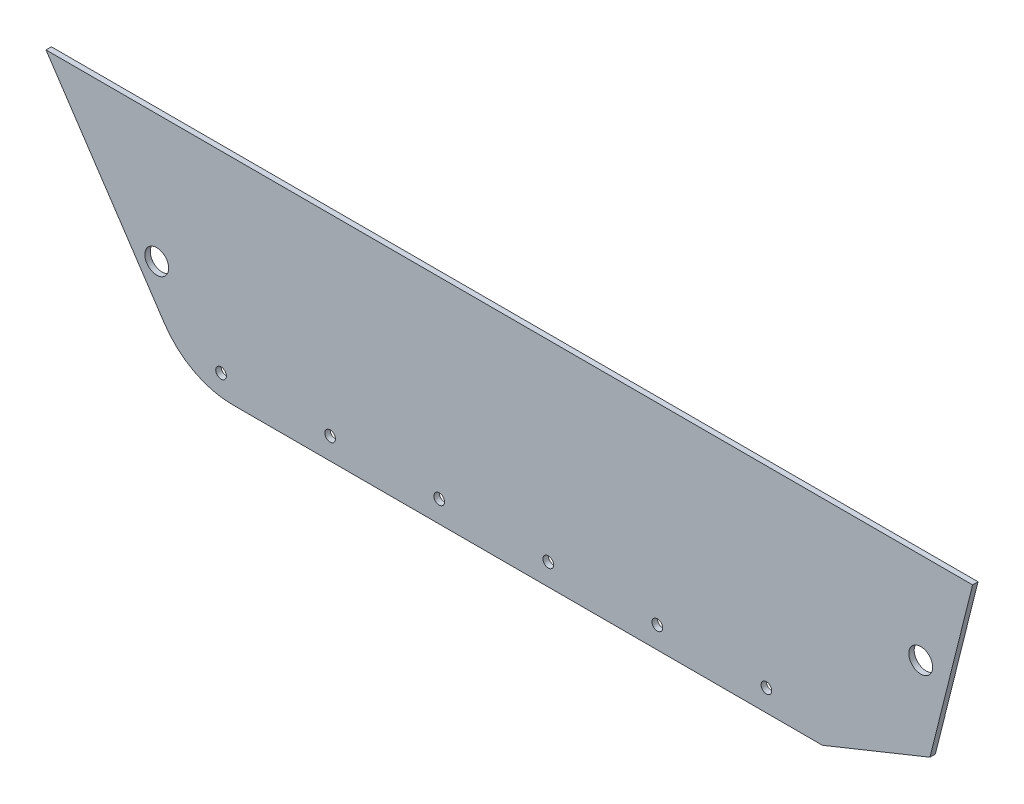
from build123d import *

# Parameters (mm, degrees)
BOSS_EXTRUDE1_DEPTH = 3.175
SKETCH1_4_R         = 3.125
CUT_EXTRUDE1_DEPTH  = 439.905857431
FILLET1_R           = 48
CUT_EXTRUDE3_DEPTH  = 10
CUT_EXTRUDE5_REACH  = 440.906
SKETCH12_R          = 7
SKETCH13_R          = 7
CUT_EXTRUDE6_DEPTH  = 10


with BuildPart() as part:
    # Sketch1 → Boss-Extrude1 (new body)
    with BuildSketch(Plane.XY):
        Polygon((-98.879411765, 3.850980392), (-31.879411765, -96.649019608), (366, -96.649019608), (403.120588235, -71.149019608), (428.120588235, 28.939617947), (-115.605170134, 28.939617947), align=None)
    extrude(amount=BOSS_EXTRUDE1_DEPTH)

    # Sketch1<4> → Cut-Extrude1 (cut, through all)
    with BuildSketch(Plane.XY):
        with Locations((-12.879411765, -83.899019608)):
            Circle(SKETCH1_4_R)
        with Locations((51.120588235, -83.899019608)):
            Circle(SKETCH1_4_R)
        with Locations((115.120588235, -83.899019608)):
            Circle(SKETCH1_4_R)
        with Locations((179.120588235, -83.899019608)):
            Circle(SKETCH1_4_R)
        with Locations((243.120588235, -83.899019608)):
            Circle(SKETCH1_4_R)
        with Locations((307.120588235, -83.899019608)):
            Circle(SKETCH1_4_R)
    extrude(amount=CUT_EXTRUDE1_DEPTH, mode=Mode.SUBTRACT)

    # Fillet1
    fillet1_edges = [part.edges().sort_by_distance(p)[0] for p in [
        (-31.879411765, -96.649019608, 1.5875),
    ]]
    fillet(fillet1_edges, radius=FILLET1_R)

    # Sketch7 → Cut-Extrude3 (cut)
    with BuildSketch(Plane.XY.offset(3.175)):
        Polygon((403.120588235, -71.149019608), (340.005873473, -96.649019608), (366, -96.649019608), align=None)
    extrude(amount=-CUT_EXTRUDE3_DEPTH, mode=Mode.SUBTRACT)

    # Sketch12 → Cut-Extrude5 (cut, up to next)
    with BuildSketch(Plane.XY.offset(3.175), mode=Mode.PRIVATE) as cut_extrude5_sk1:
        with Locations((397.677759779, -24.610405856)):
            Circle(SKETCH12_R)
    cut_extrude5_tool1 = extrude(cut_extrude5_sk1.sketch, amount=-CUT_EXTRUDE5_REACH, mode=Mode.PRIVATE) & part.part
    add(cut_extrude5_tool1.solids().sort_by_distance((397.67776, -24.610406, 3.175))[0], mode=Mode.SUBTRACT)

    # Sketch13 → Cut-Extrude6 (cut)
    with BuildSketch(Plane.XY.offset(3.175)):
        with Locations((-50.605170134, -46.060382053)):
            Circle(SKETCH13_R)
    extrude(amount=-CUT_EXTRUDE6_DEPTH, mode=Mode.SUBTRACT)


solid = part.part
